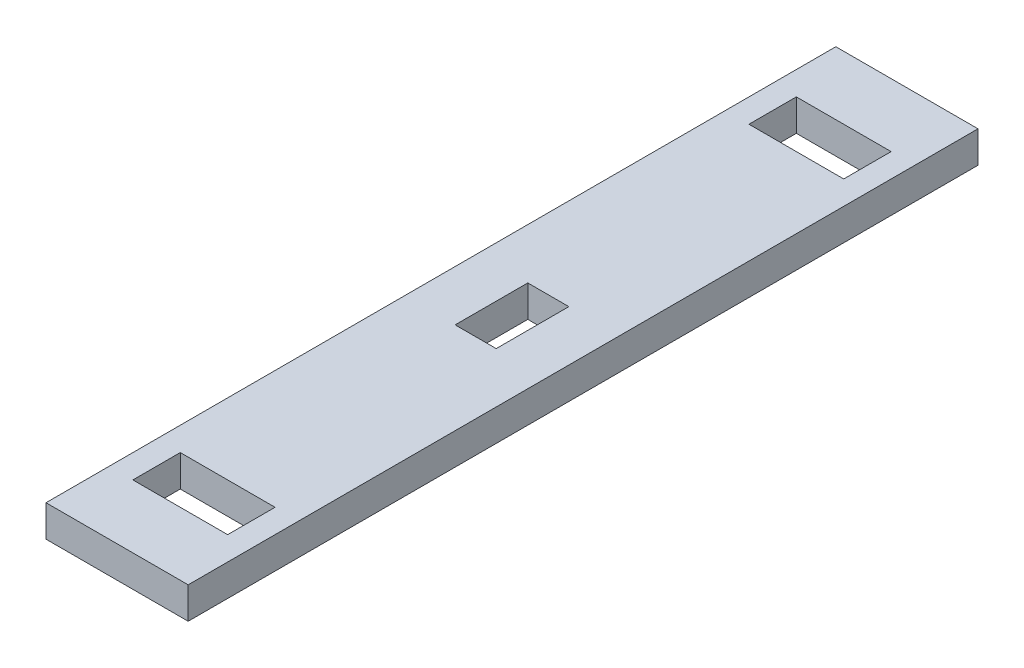
from build123d import *

# Parameters (mm, degrees)
ESQUISSE1_W                  = 9
ESQUISSE1_H                  = 50
ESQUISSE1_W_2                = 6
ESQUISSE1_H_2                = 3
BOSS_EXTRU_1_DEPTH           = 2
ENL_V_MAT_EXTRU_1_DEPTH      = 49.80910364
ENL_V_MAT_EXTRU_1_DEPTH_BACK = 49.80910364
ESQUISSE2_W                  = 2.6
ESQUISSE2_H                  = 4.6


with BuildPart() as part:
    # Esquisse1 → Boss.-Extru.1 (new body)
    with BuildSketch(Plane(origin=(0, 0, 0), x_dir=(1, 0, 0), z_dir=(0, 1, 0))):
        with Locations((3.408982136, 23.122516556)):
            Rectangle(ESQUISSE1_W, ESQUISSE1_H)
        with Locations((3.408982136, 3.622516556)):
            Rectangle(ESQUISSE1_W_2, ESQUISSE1_H_2, mode=Mode.SUBTRACT)
        with Locations((3.408982136, 42.622516556)):
            Rectangle(ESQUISSE1_W_2, ESQUISSE1_H_2, mode=Mode.SUBTRACT)
    extrude(amount=BOSS_EXTRU_1_DEPTH)

    # Esquisse2 → Enlèv. mat.-Extru.1 (cut, two sides: drawn at the far end of the back side and taken through both)
    with BuildSketch(Plane.XZ.offset(-ENL_V_MAT_EXTRU_1_DEPTH_BACK)):
        with Locations((3.408982136, -23.122516556)):
            Rectangle(ESQUISSE2_W, ESQUISSE2_H)
    extrude(amount=ENL_V_MAT_EXTRU_1_DEPTH + ENL_V_MAT_EXTRU_1_DEPTH_BACK, mode=Mode.SUBTRACT)


solid = part.part
